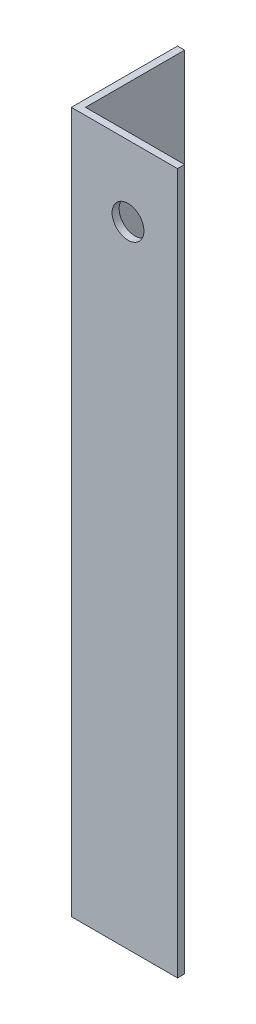
from build123d import *

# Parameters (mm, degrees)
EXTRUDE_1_DEPTH     = 99
SKETCH_2_R          = 2.25
CUT_EXTRUDE_1_DEPTH = 102.103906947


with BuildPart() as part:
    # Эскиз1 → Бобышка-Вытянуть1 (new body)
    with BuildSketch(Plane(origin=(0, 0, 0), x_dir=(1, 0, 0), z_dir=(0, 1, 0))):
        Polygon((0, 0), (0, 15), (1, 15), (1, 1), (15, 1), (15, 0), align=None)
    extrude(amount=EXTRUDE_1_DEPTH)

    # Эскиз2 → Вырез-Вытянуть1 (cut, through all)
    with BuildSketch(Plane(origin=(0, 0, -1), x_dir=(-1, 0, 0), z_dir=(0, 0, -1))):
        with Locations((-8, 89)):
            Circle(SKETCH_2_R)
    extrude(amount=-CUT_EXTRUDE_1_DEPTH, mode=Mode.SUBTRACT)


solid = part.part
